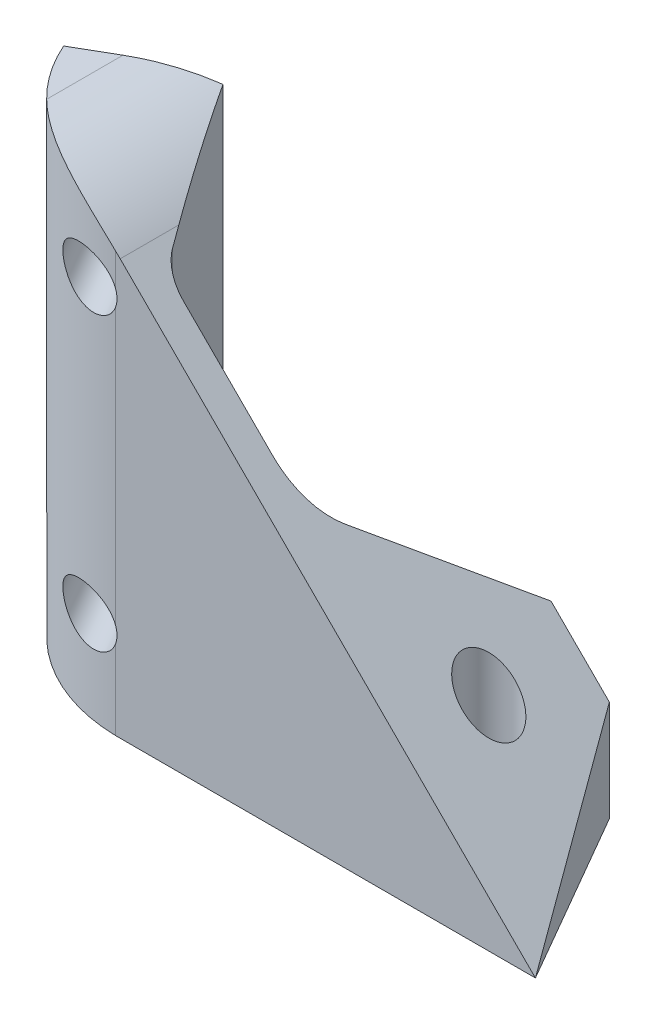
from build123d import *

# Parameters (mm, degrees)
BOSS_EXTRUDE1_DEPTH     = 80
CUT_EXTRUDE1_DEPTH      = 60
FILLET1_R               = 30
FILLET3_R               = 10
CUT_EXTRUDE3_DEPTH      = 171.057006149
CUT_EXTRUDE3_DEPTH_BACK = 171.057006149
SKETCH34_R              = 2.3
SKETCH35_R              = 4.5
CUT_EXTRUDE4_DEPTH      = 170.183744974
SKETCH36_R              = 2.3
CUT_EXTRUDE5_DEPTH      = 173.626765063
SKETCH37_R              = 4.5
CUT_EXTRUDE6_DEPTH      = 171.809835827


with BuildPart() as part:
    # Sketch31 → Boss-Extrude1 (new body)
    with BuildSketch(Plane(origin=(0, 0, 0), x_dir=(1, 0, 0), z_dir=(0, 1, 0))):
        with BuildLine():
            Line((78, 0), (150, 0))
            Line((150, 0), (132.679491924, 30))
            Line((132.679491924, 30), (122.679491924, 30))
            Line((122.679491924, 30), (105.174303469, 5))
            Line((105.174303469, 5), (84.592917657, 5))
            ThreePointArc((84.592917657, 5), (82.093089287, 5.669773895), (80.26298883, 7.499656752))
            Line((80.26298883, 7.499656752), (68.440162758, 27.973643859))
            Line((68.440162758, 27.973643859), (51.120447452, 17.972270867))
            ThreePointArc((51.120447452, 17.972270867), (61.931707937, 5.054894423), (78, 0))
        make_face()
    extrude(amount=BOSS_EXTRUDE1_DEPTH)

    # Sketch32 → Cut-Extrude1 (cut)
    with BuildSketch(Plane.XY):
        Polygon((70, 80), (150, 0), (150, 80), align=None)
    extrude(amount=-CUT_EXTRUDE1_DEPTH, mode=Mode.SUBTRACT)

    # Fillet1
    fillet1_edges = [part.edges().sort_by_distance(p)[0] for p in [
        (70, 80, -13.263657067),
    ]]
    fillet(fillet1_edges, radius=FILLET1_R)

    # Fillet3
    fillet3_edges = [part.edges().sort_by_distance(p)[0] for p in [
        (105.174303469, 22.412848265, -5),
    ]]
    fillet(fillet3_edges, radius=FILLET3_R)

    # Sketch34 → Cut-Extrude3 (cut, two sides: drawn at the far end of the back side and taken through both)
    with BuildSketch(Plane(origin=(5.000687688, 0, 8.659859718), x_dir=(-0.8659857652883414, 0, 0.5000686496051975), z_dir=(-0.5000686496051975, 0, -0.8659857652883415)).offset(-CUT_EXTRUDE3_DEPTH_BACK)):
        with Locations((-63.256949031, 15)):
            Circle(SKETCH34_R)
        with Locations((-63.256949031, 65)):
            Circle(SKETCH34_R)
    extrude(amount=CUT_EXTRUDE3_DEPTH + CUT_EXTRUDE3_DEPTH_BACK, mode=Mode.SUBTRACT)

    # Sketch35 → Cut-Extrude4 (cut, through all)
    with BuildSketch(Plane(origin=(7.000962287, 0, 12.123802779), x_dir=(-0.8659857652883414, 0, 0.5000686496051975), z_dir=(-0.5000686496051975, 0, -0.8659857652883415))):
        with Locations((-63.256949031, 65)):
            Circle(SKETCH35_R)
        with Locations((-63.256949031, 15)):
            Circle(SKETCH35_R)
    extrude(amount=-CUT_EXTRUDE4_DEPTH, mode=Mode.SUBTRACT)

    # Sketch36 → Cut-Extrude5 (cut, through all)
    with BuildSketch(Plane.XZ):
        with Locations((127, -15)):
            Circle(SKETCH36_R)
    extrude(amount=-CUT_EXTRUDE5_DEPTH, mode=Mode.SUBTRACT)

    # Sketch37 → Cut-Extrude6 (cut, through all)
    with BuildSketch(Plane(origin=(0, 4, 0), x_dir=(-1, 0, 0), z_dir=(0, -1, 0))):
        with Locations((-127, 15)):
            Circle(SKETCH37_R)
    extrude(amount=-CUT_EXTRUDE6_DEPTH, mode=Mode.SUBTRACT)


solid = part.part
